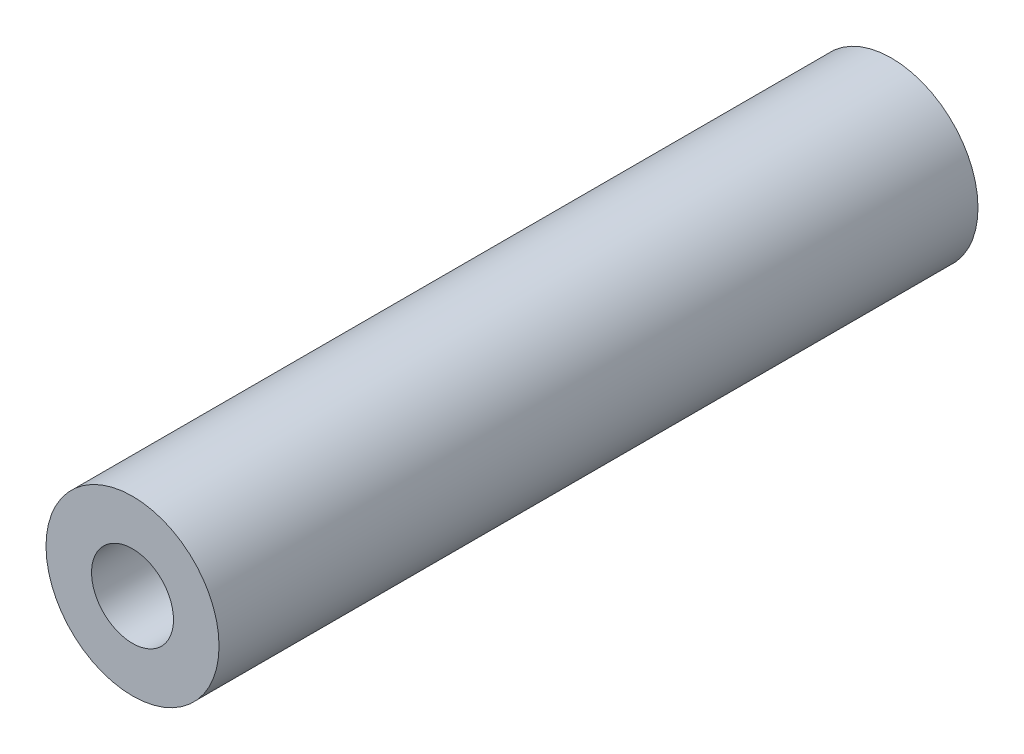
from build123d import *

# Parameters (mm, degrees)
SKETCH2_R           = 5.7
SKETCH2_R_2         = 2.7
BOSS_EXTRUDE1_DEPTH = 25


with BuildPart() as part:
    # Sketch2 → Boss-Extrude1 (new, symmetric)
    with BuildSketch(Plane.XY):
        Circle(SKETCH2_R)
        Circle(SKETCH2_R_2, mode=Mode.SUBTRACT)
    extrude(amount=BOSS_EXTRUDE1_DEPTH, both=True)


solid = part.part
